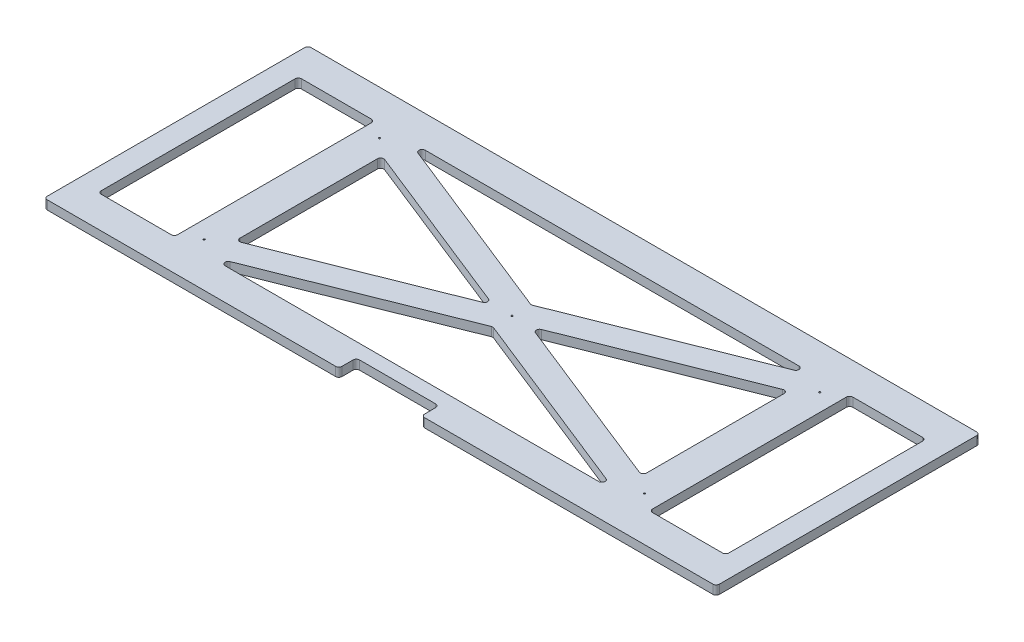
from build123d import *

# Parameters (mm, degrees)
SKETCH1_W                    = 1343.025
SKETCH1_H                    = 527.05
BOSS_EXTRUDE1_DEPTH          = 17.78
FILLET1_R                    = 6.35
SKETCH5_W                    = 152.4
SKETCH5_H                    = 400.05
CUT_EXTRUDE1_DEPTH           = 722.588935393
F_1_8_0_125_DIAMETER_HOLE2_D = 3.175
CUT_EXTRUDE2_DEPTH           = 722.588935393
FILLET2_R                    = 6.35


with BuildPart() as part:
    # Sketch1 → Boss-Extrude1 (new body)
    with BuildSketch(Plane(origin=(0, 0, 0), x_dir=(1, 0, 0), z_dir=(0, 1, 0))):
        Rectangle(SKETCH1_W, SKETCH1_H)
    extrude(amount=BOSS_EXTRUDE1_DEPTH)

    # Fillet1
    fillet1_edges = [part.edges().sort_by_distance(p)[0] for p in [
        (-671.5125, 8.89, 263.525),
        (-671.5125, 8.89, -263.525),
        (671.5125, 8.89, -263.525),
        (671.5125, 8.89, 263.525),
    ]]
    fillet(fillet1_edges, radius=FILLET1_R)

    # Sketch5 → Cut-Extrude1 (cut, through all)
    with BuildSketch(Plane(origin=(0, 17.78, 0), x_dir=(1, 0, 0), z_dir=(0, 1, 0))):
        Polygon((-406.4, 200.025), (406.4, 200.025), (0, 38.1), align=None)
        Polygon((0, -38.1), (-406.4, -200.025), (406.4, -200.025), align=None)
        Polygon((406.4, 146.74453125), (406.4, -146.74453125), (38.1, 0), align=None)
        Polygon((-406.4, 146.74453125), (-38.1, 0), (-406.4, -146.74453125), align=None)
        with Locations((550.8625, 0)):
            Rectangle(SKETCH5_W, SKETCH5_H)
        with Locations((-550.8625, 0)):
            Rectangle(SKETCH5_W, SKETCH5_H)
    extrude(amount=-CUT_EXTRUDE1_DEPTH, mode=Mode.SUBTRACT)

    # 1/8 (0.125) Diameter Hole2 (through all)
    with Locations(Plane(origin=(0, 17.78, 0), x_dir=(1, 0, 0), z_dir=(0, 1, 0))):
        with Locations((0, 0), (-439.865615282, -175.258956089), (439.865615282, 175.258956089), (439.865615282, -175.258956089), (-439.865615282, 175.258956089)):
            Hole(F_1_8_0_125_DIAMETER_HOLE2_D / 2)

    # Sketch8 → Cut-Extrude2 (cut, through all)
    with BuildSketch(Plane(origin=(0, 17.78, 0), x_dir=(1, 0, 0), z_dir=(0, 1, 0))):
        with BuildLine():
            Line((-82.55, -263.525), (-82.55, -234.95))
            ThreePointArc((-82.55, -234.95), (-80.690128061, -230.459871939), (-76.2, -228.6))
            Line((-76.2, -228.6), (76.2, -228.6))
            ThreePointArc((76.2, -228.6), (80.690128061, -230.459871939), (82.55, -234.95))
            Line((82.55, -234.95), (82.55, -263.525))
            Line((82.55, -263.525), (-82.55, -263.525))
        make_face()
    extrude(amount=-CUT_EXTRUDE2_DEPTH, mode=Mode.SUBTRACT)

    # Fillet2
    fillet2_edges = [part.edges().sort_by_distance(p)[0] for p in [
        (474.6625, 8.89, -200.025),
        (474.6625, 8.89, 200.025),
        (627.0625, 8.89, 200.025),
        (406.4, 8.89, 146.74453125),
        (406.4, 8.89, 200.025),
        (627.0625, 8.89, -200.025),
        (406.4, 8.89, -146.74453125),
        (406.4, 8.89, -200.025),
        (38.1, 8.89, 0),
        (0, 8.89, 38.1),
        (0, 8.89, -38.1),
        (-38.1, 8.89, 0),
        (-406.4, 8.89, 200.025),
        (-406.4, 8.89, -200.025),
        (-406.4, 8.89, -146.74453125),
        (-406.4, 8.89, 146.74453125),
        (-627.0625, 8.89, 200.025),
        (-474.6625, 8.89, 200.025),
        (-474.6625, 8.89, -200.025),
        (-627.0625, 8.89, -200.025),
        (-82.55, 8.89, 263.525),
        (82.55, 8.89, 263.525),
    ]]
    fillet(fillet2_edges, radius=FILLET2_R)


solid = part.part
